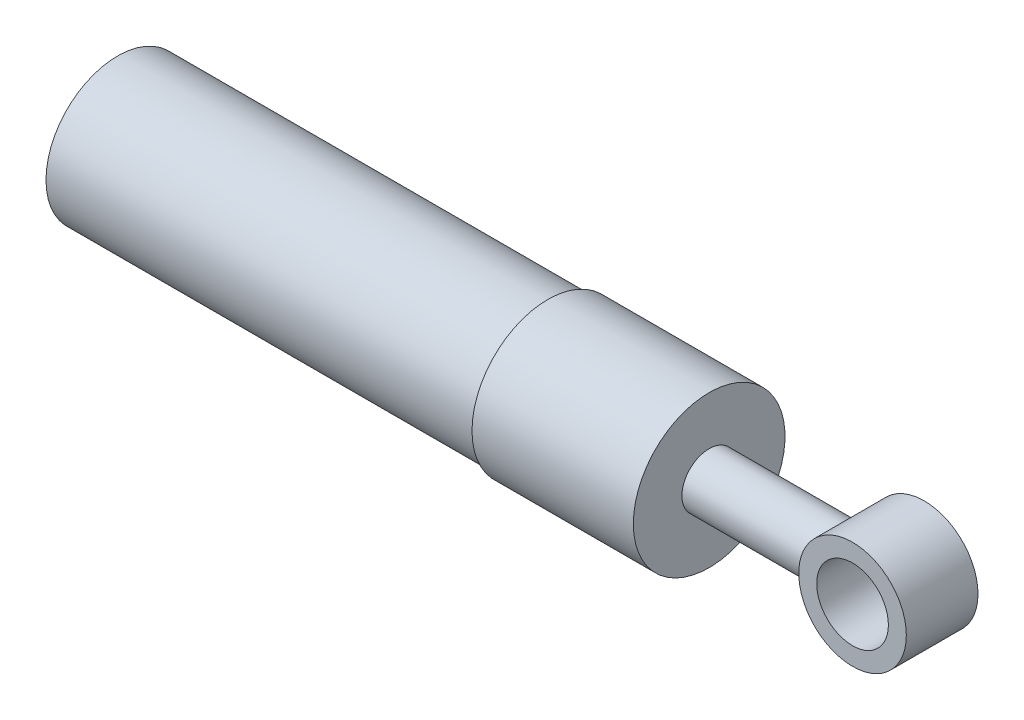
from build123d import *

# Parameters (mm, degrees)
SKETCH3_R           = 4.7625
SKETCH3_R_2         = 3.175
BOSS_EXTRUDE1_DEPTH = 3.175


with BuildPart() as part:
    # Sketch2 → Revolve1 (revolve)
    with BuildSketch(Plane.XY):
        Polygon((0, 0), (0, 6.35), (38.1, 6.35), (38.1, 6.7183), (52.3875, 6.7183), (52.3875, 2.413), (65.0875, 2.413), (65.0875, 0), align=None)
    revolve(axis=Axis((0, 0, 0), (1, 0, 0)))

    # Sketch3 → Boss-Extrude1 (add, symmetric)
    with BuildSketch(Plane.XY):
        with Locations((68.2625, 0)):
            Circle(SKETCH3_R)
        with Locations((68.2625, 0)):
            Circle(SKETCH3_R_2, mode=Mode.SUBTRACT)
    extrude(amount=BOSS_EXTRUDE1_DEPTH, both=True)


solid = part.part
